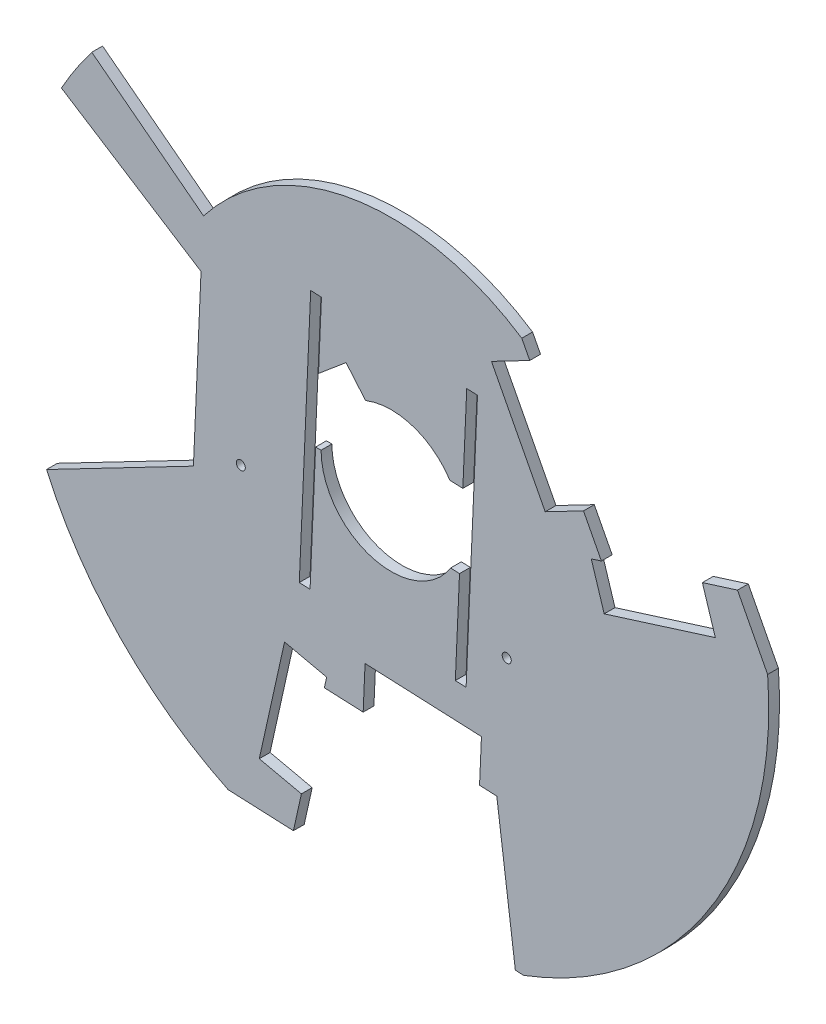
from build123d import *

# Parameters (mm, degrees)
ESQUISSE1_R             = 4.7
BOSS_EXTRU_1_DEPTH      = 5
ENL_V_START             = -10
ENL_V_MAT_EXTRU_1_DEPTH = 10
ENL_V_MAT_EXTRU_2_DEPTH = 10
ENL_V_MAT_EXTRU_3_DEPTH = 10
TROU_TARAUD_M51_D       = 4.2


with BuildPart() as part:
    # Esquisse1 → Boss.-Extru.1 (new body)
    with BuildSketch(Plane.XY):
        with BuildLine():
            ThreePointArc((61.384605816, -163.880841372), (147.549372919, -94.096665994), (174.481446525, 13.461976776))
            Line((174.481446525, 13.461976776), (160.509166102, 40.333250621))
            Line((160.509166102, 40.333250621), (97.428399446, 20.476493551))
            Line((97.428399446, 20.476493551), (60.521806411, 91.454683092))
            Line((60.521806411, 91.454683092), (113.006926452, 131.688824037))
            Line((113.006926452, 131.688824037), (111.232668913, 135.101048724))
            ThreePointArc((111.232668913, 135.101048724), (-147.549372919, 94.096665994), (-75.582309389, -157.836353567))
            Line((-75.582309389, -157.836353567), (-45.324963396, -159.171640695))
            Line((-45.324963396, -159.171640695), (-30.981036128, -94.613715745))
            Line((-30.981036128, -94.613715745), (48.941175647, -98.140763381))
            Line((48.941175647, -98.140763381), (57.542403784, -163.71128113))
            Line((57.542403784, -163.71128113), (61.384605816, -163.880841372))
        make_face()
        with Locations((-45.530301203, -113.99110802)):
            Circle(ESQUISSE1_R, mode=Mode.SUBTRACT)
        with BuildLine():
            Line((-20.91966999, 40.95026504), (-11.899961997, 30.243030676))
            ThreePointArc((-11.899961997, 30.243030676), (9.877796967, 30.962543937), (27.21544776, 17.764273225))
            Line((27.21544776, 17.764273225), (33.203827505, 17.5))
            Line((33.203827505, 17.5), (35.013781495, 58.513204539))
            Line((35.013781495, 58.513204539), (40.008919731, 58.292764062))
            Line((40.008919731, 58.292764062), (34.718348278, -61.590553601))
            Line((34.718348278, -61.590553601), (29.723210042, -61.370113123))
            Line((29.723210042, -61.370113123), (31.660744165, -17.465967651))
            Line((31.660744165, -17.465967651), (27.523349483, -17.283380261))
            ThreePointArc((27.523349483, -17.283380261), (-8.99280662, -31.231065129), (-32.5, 0))
            Line((-32.5, 0), (-35.034065472, 0))
            Line((-35.034065472, 0), (-37.611253378, -58.398575491))
            Line((-37.611253378, -58.398575491), (-42.606391614, -58.178135013))
            Line((-42.606391614, -58.178135013), (-37.315820161, 61.705182649))
            Line((-37.315820161, 61.705182649), (-32.320681925, 61.484742172))
            Line((-32.320681925, 61.484742172), (-33.702084088, 30.182438475))
            Line((-33.702084088, 30.182438475), (-20.91966999, 40.95026504))
        make_face(mode=Mode.SUBTRACT)
        with Locations((14.416088947, -86.607403569)):
            Circle(ESQUISSE1_R, mode=Mode.SUBTRACT)
        with Locations((67.796167173, 55.788401035)):
            Circle(ESQUISSE1_R, mode=Mode.SUBTRACT)
        with Locations((121.484345953, 17.565156526)):
            Circle(ESQUISSE1_R, mode=Mode.SUBTRACT)
    extrude(amount=BOSS_EXTRU_1_DEPTH)

    # Esquisse2 → Enlèv. mat.-Extru.1 (cut)
    with BuildSketch(Plane.XY.offset(5).offset(ENL_V_START)):
        with BuildLine():
            Line((-88.148964429, 43.929034477), (-152.860619324, 85.197600084))
            ThreePointArc((-152.860619324, 85.197600084), (-174.829838257, 7.715416702), (-159.771465705, -71.400831554))
            Line((-159.771465705, -71.400831554), (-91.676012064, -35.993177298))
            Line((-91.676012064, -35.993177298), (-88.148964429, 43.929034477))
        make_face()
    extrude(amount=ENL_V_MAT_EXTRU_1_DEPTH, mode=Mode.SUBTRACT)

    # Esquisse3 → Enlèv. mat.-Extru.2 (cut)
    with BuildSketch(Plane.XY.offset(5)):
        Polygon((40.948954466, -97.788058617), (-12.998538482, -95.407301464), (-12.116776573, -75.42674852), (41.830716375, -77.807505674), align=None)
        Polygon((-49.436008781, -85.46488415), (-29.912121681, -89.802836721), (-41.624593625, -142.517331891), (-61.148480724, -138.179379319), align=None)
        Polygon((64.212465714, 84.356864138), (89.124416013, 36.446586197), (71.379868627, 27.219937939), (46.467918329, 75.130215879), align=None)
        Polygon((98.732765194, -0.080397389), (92.727598771, 18.996761106), (144.235926707, 35.210710447), (150.24109313, 16.133551952), align=None)
    extrude(amount=-ENL_V_MAT_EXTRU_2_DEPTH, mode=Mode.SUBTRACT)

    # Esquisse4 → Enlèv. mat.-Extru.3 (cut)
    with BuildSketch(Plane.XY.offset(5).offset(ENL_V_START)):
        with BuildLine():
            Line((-138.786838194, 106.59837496), (-86.973339578, 66.801843637))
            ThreePointArc((-86.973339578, 66.801843637), (-18.079312073, 108.166476256), (60.521806411, 91.454683092))
            Line((60.521806411, 91.454683092), (113.006926452, 131.688824037))
            Line((113.006926452, 131.688824037), (111.232668913, 135.101048724))
            ThreePointArc((111.232668913, 135.101048724), (-19.821923825, 173.873779898), (-138.786838194, 106.59837496))
        make_face()
    extrude(amount=ENL_V_MAT_EXTRU_3_DEPTH, mode=Mode.SUBTRACT)

    # Trou taraudé M51 (through all)
    with Locations(Plane(origin=(0, 0, 5), x_dir=(0.9990276471851475, -0.04408809544206669, 0), z_dir=(0, 0, 1))):
        with Locations((-68.568956805, -27.662548456), (55.280905682, -37.98337033), (-87.299337242, 135.559338217)):
            Hole(TROU_TARAUD_M51_D / 2)


solid = part.part
